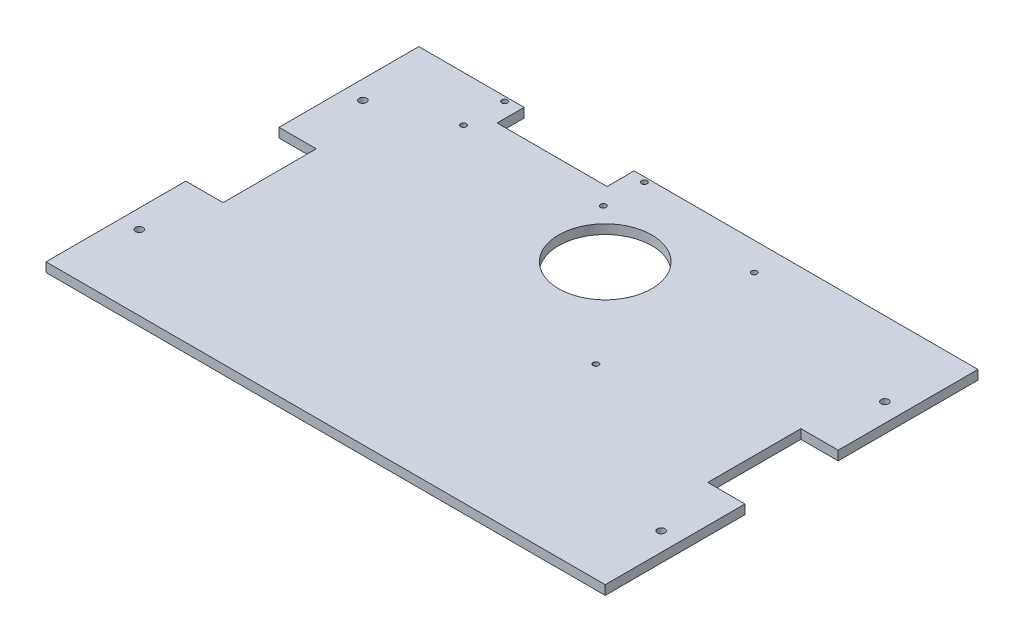
from build123d import *

# Parameters (mm, degrees)
SKETCH1_W           = 300
SKETCH1_H           = 200
BOSS_EXTRUDE1_DEPTH = 5
SKETCH2_R           = 2
SKETCH2_R_2         = 25
CUT_EXTRUDE2_DEPTH  = 181.346887969
SKETCH4_R           = 1.5
CUT_EXTRUDE3_DEPTH  = 181.346887969
SKETCH6_W           = 59
SKETCH6_H           = 14.5
CUT_EXTRUDE4_DEPTH  = 5
SKETCH8_R           = 1.5
CUT_EXTRUDE6_DEPTH  = 181.346887969
SKETCH9_W           = 20
SKETCH9_H           = 50
CUT_EXTRUDE7_DEPTH  = 181.346887969


with BuildPart() as part:
    # Sketch1 → Boss-Extrude1 (new body)
    with BuildSketch(Plane(origin=(0, 0, 0), x_dir=(1, 0, 0), z_dir=(0, 1, 0))):
        Rectangle(SKETCH1_W, SKETCH1_H)
    extrude(amount=BOSS_EXTRUDE1_DEPTH)

    # Sketch2 → Cut-Extrude2 (cut, through all)
    with BuildSketch(Plane(origin=(0, 5, 0), x_dir=(1, 0, 0), z_dir=(0, 1, 0))):
        with Locations((-140, 0)):
            Circle(SKETCH2_R)
        with Locations((-140, 60)):
            Circle(SKETCH2_R)
        with Locations((-140, -60)):
            Circle(SKETCH2_R)
        with Locations((140, -60)):
            Circle(SKETCH2_R)
        with Locations((140, 60)):
            Circle(SKETCH2_R)
        with Locations((140, 0)):
            Circle(SKETCH2_R)
        with Locations((0, 50)):
            Circle(SKETCH2_R_2)
    extrude(amount=-CUT_EXTRUDE2_DEPTH, mode=Mode.SUBTRACT)

    # Sketch4 → Cut-Extrude3 (cut, through all)
    with BuildSketch(Plane(origin=(0, 5, 0), x_dir=(1, 0, 0), z_dir=(0, 1, 0))):
        with Locations((-101.5, 97.5)):
            Circle(SKETCH4_R)
        with Locations((-26.5, 97.5)):
            Circle(SKETCH4_R)
        with Locations((-26.5, 75.5)):
            Circle(SKETCH4_R)
        with Locations((-101.5, 75.5)):
            Circle(SKETCH4_R)
    extrude(amount=-CUT_EXTRUDE3_DEPTH, mode=Mode.SUBTRACT)

    # Sketch6 → Cut-Extrude4 (cut)
    with BuildSketch(Plane.XZ):
        with Locations((-64, -92.75)):
            Rectangle(SKETCH6_W, SKETCH6_H)
    extrude(amount=-CUT_EXTRUDE4_DEPTH, mode=Mode.SUBTRACT)

    # Sketch8 → Cut-Extrude6 (cut, through all)
    with BuildSketch(Plane(origin=(0, 5, 0), x_dir=(1, 0, 0), z_dir=(0, 1, 0))):
        with Locations((45, 85)):
            Circle(SKETCH8_R)
        with Locations((45, 0)):
            Circle(SKETCH8_R)
    extrude(amount=-CUT_EXTRUDE6_DEPTH, mode=Mode.SUBTRACT)

    # Sketch9 → Cut-Extrude7 (cut, through all)
    with BuildSketch(Plane(origin=(0, 5, 0), x_dir=(1, 0, 0), z_dir=(0, 1, 0))):
        with Locations((-140, 0)):
            Rectangle(SKETCH9_W, SKETCH9_H)
        with Locations((140, 0)):
            Rectangle(SKETCH9_W, SKETCH9_H)
    extrude(amount=-CUT_EXTRUDE7_DEPTH, mode=Mode.SUBTRACT)


solid = part.part
